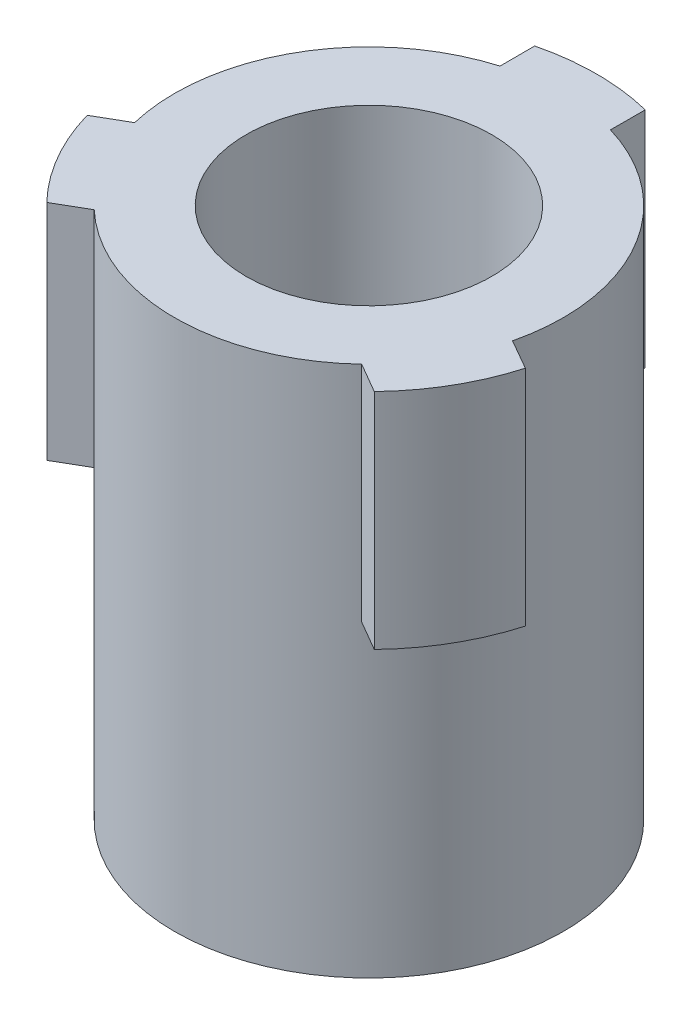
from build123d import *

# Parameters (mm, degrees)
SKETCH1_R           = 8.7
SKETCH1_R_2         = 5.5
BOSS_EXTRUDE1_DEPTH = 68.8
BOSS_EXTRUDE2_START = 4
SKETCH2_R           = 16
SKETCH2_R_2         = 5.5
BOSS_EXTRUDE2_DEPTH = 4
FILLET1_R           = 2
FILLET2_R           = 1
BOSS_EXTRUDE6_START = -10
BOSS_EXTRUDE6_DEPTH = 10
CUT_EXTRUDE1_START  = -23
SKETCH10_R          = 8.7
SKETCH10_R_2        = 7.2
CUT_EXTRUDE1_DEPTH  = 23
SKETCH11_R          = 18.546055896
CUT_EXTRUDE2_DEPTH  = 54.972215104
SKETCH12_R          = 7.3
CUT_EXTRUDE3_DEPTH  = 15


with BuildPart() as part:
    # Sketch1 → Boss-Extrude1 (new body)
    with BuildSketch(Plane(origin=(0, 0, 0), x_dir=(1, 0, 0), z_dir=(0, 1, 0))):
        with Locations(Location((0, 0, 0), (0, 0, 90))):
            Circle(SKETCH1_R)
        with Locations(Location((0, 0, 0), (0, 0, 90))):
            Circle(SKETCH1_R_2, mode=Mode.SUBTRACT)
    extrude(amount=BOSS_EXTRUDE1_DEPTH)

    # Sketch2 → Boss-Extrude2 (add)
    with BuildSketch(Plane.XZ.offset(BOSS_EXTRUDE2_START)):
        with Locations(Location((0, 0, 0), (0, 0, 270))):
            Circle(SKETCH2_R)
        with Locations(Location((0, 0, 0), (0, 0, 270))):
            Circle(SKETCH2_R_2, mode=Mode.SUBTRACT)
    extrude(amount=-BOSS_EXTRUDE2_DEPTH)

    # Fillet1
    fillet1_edges = [part.edges().sort_by_distance(p)[0] for p in [
        (0, 0, 16),
        (0, -4, 16),
    ]]
    fillet(fillet1_edges, radius=FILLET1_R - 0.0001)  # a hair under: the kernel refuses the full size

    # Fillet2
    fillet2_edges = [part.edges().sort_by_distance(p)[0] for p in [
        (0, 0, 8.7),
    ]]
    fillet(fillet2_edges, radius=FILLET2_R)

    # Sketch7 → Boss-Extrude6 (add)
    with BuildSketch(Plane(origin=(0, 68.8, 0), x_dir=(1, 0, 0), z_dir=(0, 1, 0)).offset(BOSS_EXTRUDE6_START)):
        with BuildLine():
            Line((-8.459778344, -2.030307951), (-9.805994948, -2.807572454))
            ThreePointArc((-9.805994948, -2.807572454), (-8.832386986, -5.101856537), (-7.331446138, -7.091537035))
            Line((-7.331446138, -7.091537035), (-5.988187435, -6.311228981))
            ThreePointArc((-5.988187435, -6.311228981), (-7.534421013, -4.35), (-8.459778344, -2.030307951))
        make_face()
        with BuildLine():
            Line((-2.471590909, 8.341536931), (-2.475728155, 9.89498712))
            ThreePointArc((-2.475728155, 9.89498712), (0, 10.2), (2.475728155, 9.89498712))
            Line((2.475728155, 9.89498712), (2.471590909, 8.341536931))
            ThreePointArc((2.471590909, 8.341536931), (0, 8.7), (-2.471590909, 8.341536931))
        make_face()
        with BuildLine():
            Line((8.459778344, -2.030307951), (9.807174294, -2.803450085))
            ThreePointArc((9.807174294, -2.803450085), (8.833459119, -5.1), (7.331446138, -7.091537035))
            Line((7.331446138, -7.091537035), (5.988187435, -6.311228981))
            ThreePointArc((5.988187435, -6.311228981), (7.534421013, -4.35), (8.459778344, -2.030307951))
        make_face()
    extrude(amount=BOSS_EXTRUDE6_DEPTH)

    # Sketch10 → Cut-Extrude1 (cut)
    with BuildSketch(Plane(origin=(0, 45, 0), x_dir=(1, 0, 0), z_dir=(0, 1, 0)).offset(CUT_EXTRUDE1_START)):
        with Locations(Location((0, 0, 0), (0, 0, 90))):
            Circle(SKETCH10_R)
        with Locations(Location((0, 0, 0), (0, 0, 270))):
            Circle(SKETCH10_R_2, mode=Mode.SUBTRACT)
    extrude(amount=CUT_EXTRUDE1_DEPTH, mode=Mode.SUBTRACT)

    # Sketch11 → Cut-Extrude2 (cut, through all)
    with BuildSketch(Plane.XZ.offset(-45)):
        Circle(SKETCH11_R)
    extrude(amount=CUT_EXTRUDE2_DEPTH, mode=Mode.SUBTRACT)

    # Sketch12 → Cut-Extrude3 (cut)
    with BuildSketch(Plane.XZ.offset(-45)):
        with Locations(Location((0, 0, 0), (0, 0, 270))):
            Circle(SKETCH12_R)
    extrude(amount=-CUT_EXTRUDE3_DEPTH, mode=Mode.SUBTRACT)


solid = part.part
